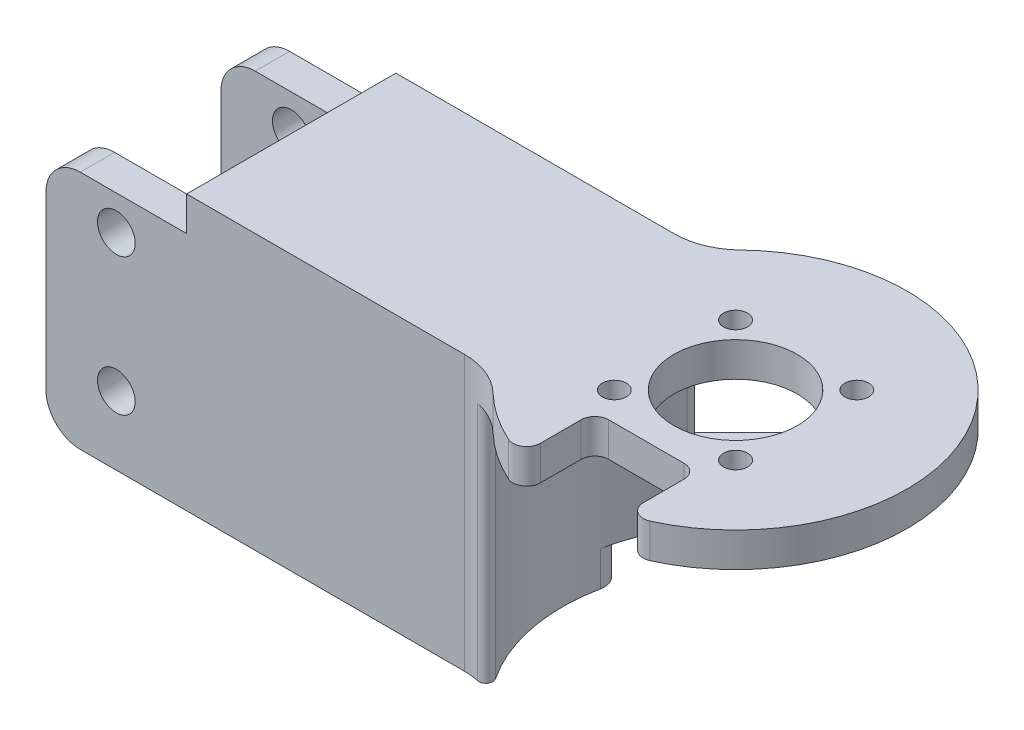
from build123d import *

# Parameters (mm, degrees)
SKETCH1_R               = 1.7499999999999998
SKETCH1_R_2             = 9
MOTOR_PLATE_DEPTH       = 5
BOSS_EXTRUDE1_DEPTH     = 35
BOSS_EXTRUDE2_START     = 35
BOSS_EXTRUDE2_DEPTH     = 35
CUT_EXTRUDE5_DEPTH      = 100.75732766200707
CUT_EXTRUDE5_DEPTH_BACK = 100.75732766200707
SKETCH11_R              = 2.7500000000000084
SKETCH11_R_2            = 2.750000000000008
CUT_EXTRUDE7_DEPTH      = 100.75732766200707
CUT_EXTRUDE7_DEPTH_BACK = 100.75732766200707
SKETCH14_W              = 20.499999999999986
SKETCH14_H              = 5
FILLET4_R               = 5
BOSS_EXTRUDE5_DEPTH     = 7.5
CUT_EXTRUDE14_DEPTH     = 98.1044493253111
SKETCH27_R              = 2.3500000000000005
CUT_EXTRUDE15_DEPTH     = 4
SKETCH28_R              = 1.7499999999999998
SKETCH28_R_2            = 1.7500000000000004
CUT_EXTRUDE16_DEPTH     = 7
FILLET5_R               = 2.5
FILLET6_R               = 10


with BuildPart() as part:
    # Sketch1 → Motor Plate (new body)
    with BuildSketch(Plane(origin=(0, 0, 0), x_dir=(1, 0, 0), z_dir=(0, 1, 0))):
        with BuildLine():
            Line((-24.237109976232734, 15.250000000000002), (-85.24999999999999, 15.25))
            Line((-85.24999999999999, 15.25), (-85.24999999999999, 10.25))
            Line((-85.24999999999999, 10.25), (-64.75, 10.25))
            Line((-64.75, 10.25), (-64.75, -10.250000000000002))
            Line((-64.75, -10.250000000000002), (-85.24999999999999, -10.250000000000002))
            Line((-85.24999999999999, -10.250000000000002), (-85.24999999999999, -15.250000000000002))
            Line((-85.24999999999999, -15.250000000000002), (-24.237109976232734, -15.25))
            ThreePointArc((-24.237109976232734, -15.25), (-20.505009839771837, -15.972531133362475), (-17.31222141159481, -18.03571428571429))
            ThreePointArc((-17.31222141159481, -18.03571428571429), (-14.020240375434447, -20.698619756279353), (-10.326086956521745, -22.76778268005806))
            ThreePointArc((-10.326086956521745, -22.76778268005806), (-8.416527322228076, -22.627457016016997), (-7.500000000000001, -20.94636006565341))
            Line((-7.500000000000001, -20.94636006565341), (-7.500000000000001, -15))
            ThreePointArc((-7.500000000000001, -15), (-6.914213562373096, -13.585786437626904), (-5.500000000000001, -13))
            Line((-5.500000000000001, -13), (5.499999999999999, -13))
            ThreePointArc((5.499999999999999, -13), (6.914213562373094, -13.585786437626904), (7.499999999999999, -15))
            Line((7.499999999999999, -15), (7.499999999999999, -20.94636006565341))
            ThreePointArc((7.499999999999999, -20.94636006565341), (8.416527322228072, -22.627457016016997), (10.32608695652174, -22.76778268005806))
            ThreePointArc((10.32608695652174, -22.76778268005806), (20.698619756279356, 14.020240375434444), (-17.31222141159481, 18.035714285714285))
            ThreePointArc((-17.31222141159481, 18.035714285714285), (-20.50500983977184, 15.972531133362477), (-24.237109976232734, 15.250000000000002))
        make_face()
        with Locations(Location((8.838834764831846, 8.838834764831835, 0), (0, 0, 270))):
            Circle(SKETCH1_R, mode=Mode.SUBTRACT)
        with Locations(Location((-8.838834764831843, 8.838834764831846, 0), (0, 0, 270))):
            Circle(SKETCH1_R, mode=Mode.SUBTRACT)
        with Locations(Location((-8.838834764831843, -8.838834764831846, 0), (0, 0, 270))):
            Circle(SKETCH1_R, mode=Mode.SUBTRACT)
        with Locations(Location((8.838834764831846, -8.838834764831835, 0), (0, 0, 270))):
            Circle(SKETCH1_R, mode=Mode.SUBTRACT)
        with Locations(Location((0, 0, 0), (0, 0, 270))):
            Circle(SKETCH1_R_2, mode=Mode.SUBTRACT)
    extrude(amount=MOTOR_PLATE_DEPTH)

    # Sketch3 → Boss-Extrude1 (add)
    with BuildSketch(Plane.XZ):
        Polygon((-85.24999999999999, 15.250000000000002), (-85.24999999999999, 10.250000000000002), (-64.75, 10.250000000000002), (-64.75, -10.25), (-85.24999999999999, -10.25), (-85.24999999999999, -15.25), (-59.75, -15.25), (-59.75, 15.250000000000002), align=None)
    extrude(amount=BOSS_EXTRUDE1_DEPTH)

    # Sketch4 → Boss-Extrude2 (add)
    with BuildSketch(Plane.XZ.offset(BOSS_EXTRUDE2_START)):
        with BuildLine():
            Line((-59.75, -15.25), (-59.75, 15.250000000000002))
            Line((-59.75, 15.250000000000002), (-24.237109976232734, 15.25))
            ThreePointArc((-24.237109976232734, 15.25), (-23.15840811564324, 15.30835012203906), (-22.09229473209558, 15.482719540807848))
            ThreePointArc((-22.09229473209558, 15.482719540807848), (-21.052891601024875, 15.071238646911935), (-21.04437270453208, 13.953382295083351))
            ThreePointArc((-21.04437270453208, 13.953382295083351), (-25.250000000000007, 3.09e-15), (-21.044372704532076, -13.953382295083353))
            ThreePointArc((-21.044372704532076, -13.953382295083353), (-21.05289160102487, -15.071238646911937), (-22.092294732095578, -15.48271954080785))
            ThreePointArc((-22.092294732095578, -15.48271954080785), (-23.15840811564324, -15.308350122039062), (-24.237109976232734, -15.25))
            Line((-24.237109976232734, -15.25), (-59.75, -15.25))
        make_face()
    extrude(amount=-BOSS_EXTRUDE2_DEPTH)

    # Sketch11 → Cut-Extrude5 (cut, two sides: drawn at the far end of the back side and taken through both)
    with BuildSketch(Plane(origin=(-4.3e-16, 0, -15.250000000000002), x_dir=(-1, 0, 6e-17), z_dir=(-6e-17, 0, -1)).offset(-CUT_EXTRUDE5_DEPTH_BACK)):
        with Locations((75, -25)):
            Circle(SKETCH11_R)
        with Locations((75, -5.000000000000001)):
            Circle(SKETCH11_R_2)
    extrude(amount=CUT_EXTRUDE5_DEPTH + CUT_EXTRUDE5_DEPTH_BACK, mode=Mode.SUBTRACT)

    # Sketch14 → Cut-Extrude7 (cut, two sides: drawn at the far end of the back side and taken through both)
    with BuildSketch(Plane(origin=(-4.3e-16, 0, -15.250000000000002), x_dir=(-1, 0, 6e-17), z_dir=(-6e-17, 0, -1)).offset(-CUT_EXTRUDE7_DEPTH_BACK)):
        with Locations((75, 2.5)):
            Rectangle(SKETCH14_W, SKETCH14_H)
    extrude(amount=CUT_EXTRUDE7_DEPTH + CUT_EXTRUDE7_DEPTH_BACK, mode=Mode.SUBTRACT)

    # Fillet4
    fillet4_edges = [part.edges().sort_by_distance(p)[0] for p in [
        (-85.24999999999999, 0, -12.75),
        (-85.24999999999999, 0, 12.75),
        (-85.24999999999999, -35, -12.75),
        (-85.24999999999999, -35, 12.750000000000002),
    ]]
    fillet(fillet4_edges, radius=FILLET4_R)

    # Sketch24 → Boss-Extrude5 (add)
    with BuildSketch(Plane(origin=(0, -29.8908, 0), x_dir=(-1, 0, 0), z_dir=(0, -1, 0))):
        with BuildLine():
            Line((24.237109976232734, 15.25), (28.819440187957916, 15.25))
            Line((28.819440187957916, 15.25), (13.970450097258862, 30.09899009069905))
            ThreePointArc((13.970450097258862, 30.09899009069905), (12.44663498380185, 30.730174977242044), (10.92281987034484, 30.09899009069905))
            Line((10.92281987034484, 30.09899009069905), (8.062504135197518, 27.238674355551726))
            Line((8.062504135197518, 27.238674355551726), (8.165668965896261, 23.893186274320946))
            ThreePointArc((8.165668965896261, 23.893186274320946), (15.42746120991581, 19.988895432628166), (21.044372704532083, 13.95338229508334))
            ThreePointArc((21.044372704532083, 13.95338229508334), (21.052891601024868, 15.07123864691193), (22.092294732095578, 15.482719540807848))
            ThreePointArc((22.092294732095578, 15.482719540807848), (23.15840811564324, 15.30835012203906), (24.237109976232734, 15.25))
        make_face()
    extrude(amount=-BOSS_EXTRUDE5_DEPTH)

    # Sketch26 → Cut-Extrude14 (cut, through all)
    with BuildSketch(Plane.XZ.offset(29.8908)):
        with BuildLine():
            Line((-18.976555851670547, -8.317283119898706), (-13.970450097258862, -30.09899009069905))
            Line((-13.970450097258862, -30.09899009069905), (-30.098990090699047, -13.970450097258864))
            ThreePointArc((-30.098990090699047, -13.970450097258864), (-30.730174977242033, -12.446634983801854), (-30.098990090699044, -10.92281987034485))
            Line((-30.098990090699044, -10.92281987034485), (-27.238674355551726, -8.062504135197523))
            Line((-27.238674355551726, -8.062504135197523), (-18.976555851670547, -8.317283119898706))
        make_face()
    extrude(amount=CUT_EXTRUDE14_DEPTH, mode=Mode.SUBTRACT)

    # Sketch27 → Cut-Extrude15 (cut)
    with BuildSketch(Plane.XZ.offset(29.8908)):
        with Locations(Location((-27.29099835192915, -12.473575752165065, 0), (0, 0, 270))):
            Circle(SKETCH27_R)
        with Locations(Location((-12.47357575216505, -27.290998351929158, 0), (0, 0, 270))):
            Circle(SKETCH27_R)
    extrude(amount=-CUT_EXTRUDE15_DEPTH, mode=Mode.SUBTRACT)

    # Sketch28 → Cut-Extrude16 (cut)
    with BuildSketch(Plane.XZ.offset(29.8908)):
        with Locations(Location((-27.29099835192915, -12.473575752165065, 0), (0, 0, 270))):
            Circle(SKETCH28_R)
        with Locations(Location((-12.47357575216505, -27.290998351929158, 0), (0, 0, 270))):
            Circle(SKETCH28_R_2)
    extrude(amount=-CUT_EXTRUDE16_DEPTH, mode=Mode.SUBTRACT)

    # Fillet5
    # the kernel refuses this fillet: 2.5 mm, written as the material it takes off along each edge
    with BuildSketch(Plane(origin=(-8.165668965896261, -34.068034873717735, -23.89318627432096), x_dir=(-0.9355866460023518, 0, 0.35309719316651356), z_dir=(0, 1, 0))) as fillet5_piece_1:
        with BuildLine():
            CenterArc((1.6727559192968875, -2.498754534741212), FILLET5_R, 91.80863723012877, 65.74822155289536)
            Line((-0.6378911862633408, -1.54433850723217), (0, 0))
            ThreePointArc((0, 0), (0.7969261690989898, -0.0125791991137666), (1.59385233819798, 7e-17))
        make_face()
    extrude(amount=15.854469747435477, mode=Mode.SUBTRACT)
    with BuildSketch(Plane(origin=(-28.819440187957913, -29.8908, -15.249999999999998), x_dir=(-0.5820598075620075, 0, 0.8131459773133474), z_dir=(0, -1, 0))) as fillet5_piece_2:
        with BuildLine():
            CenterArc((4.594416541128744, 2.123375145412493), FILLET5_R, 144.40445067780377, 93.73659766899215)
            Line((2.5615515978453756, 3.578524664317512), (2.3582651035170388, 3.724039616208014))
            Line((2.3582651035170388, 3.724039616208014), (-0.20328649432833684, 0.14551495189050187))
            Line((-0.20328649432833684, 0.14551495189050187), (0.0408506494173984, -0.24663986790901668))
            ThreePointArc((0.0408506494173984, -0.24663986790901668), (1.826086075758527, 0.04904641812113162), (3.142884119812632, -0.21233751454124886))
            Line((3.142884119812632, -0.21233751454124886), (3.274841612659551, 3e-17))
        make_face()
    extrude(amount=16.111297914021037, mode=Mode.SUBTRACT)
    with BuildSketch(Plane(origin=(-23.893186274320946, -29.8908, -8.16566896589627), x_dir=(-0.2624644085594799, 0, 0.9649416740091198), z_dir=(0, -1, 0))) as fillet5_piece_3:
        with BuildLine():
            CenterArc((3.375802522576318, 2.494923627384301), FILLET5_R, 163.59172174149506, 102.75638657572608)
            Line((0.977619595016342, 3.2011237732069016), (0, 0))
            ThreePointArc((0, 0), (1.6082832772651305, 0.05127136341856297), (3.216566554530266, 6e-17))
        make_face()
    extrude(amount=13.476895876087362, mode=Mode.SUBTRACT)

    # Fillet6
    fillet6_edges = [part.edges().sort_by_distance(p)[0] for p in [
        (-28.819440187957916, -26.1408, -15.25),
    ]]
    fillet(fillet6_edges, radius=FILLET6_R)


solid = part.part
